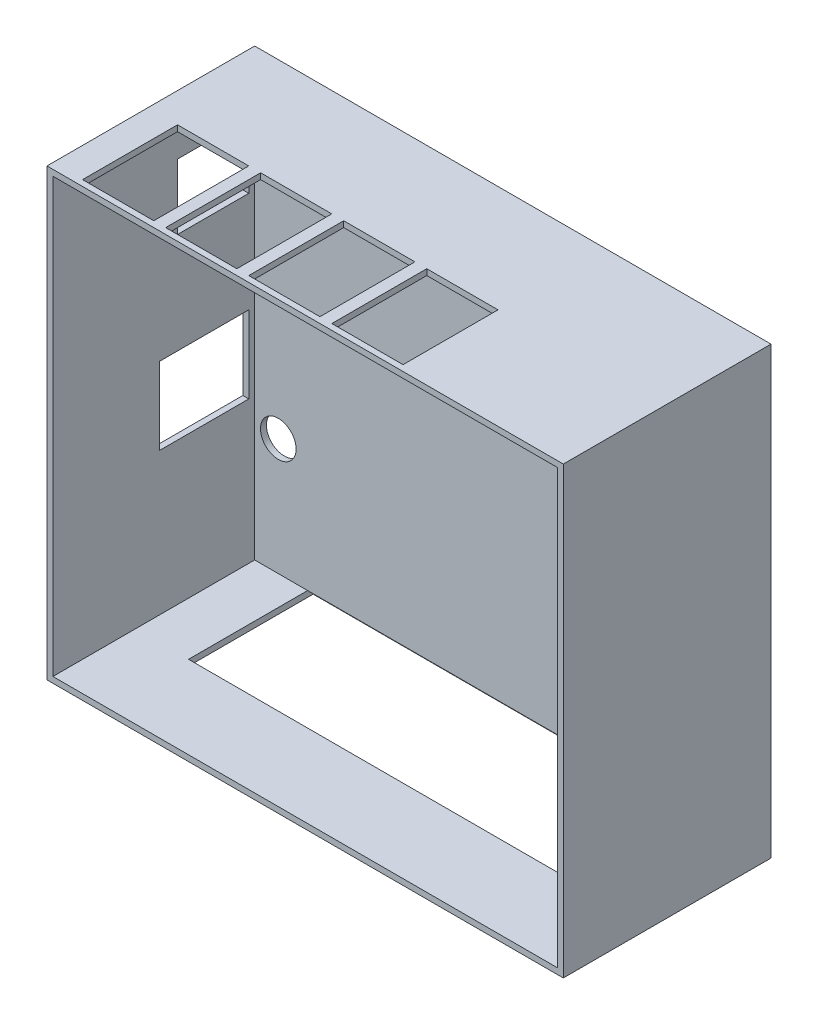
from build123d import *

# Parameters (mm, degrees)
ESQUISSE1_W              = 85
ESQUISSE1_H              = 73
BOSS_EXTRU_2_DEPTH       = 1
ESQUISSE6_W              = 35
ESQUISSE6_H              = 73
BOSS_EXTRU_4_DEPTH       = 1
ESQUISSE8_W              = 35
ESQUISSE8_H              = 73
BOSS_EXTRU_6_DEPTH       = 1
ESQUISSE10_W             = 12
ESQUISSE10_H             = 11
ENL_V_MAT_EXTRU_1_DEPTH  = 1
ESQUISSE11_W             = 15
ESQUISSE11_H             = 13
ENL_V_MAT_EXTRU_2_DEPTH  = 1
ESQUISSE13_W             = 87
ESQUISSE13_H             = 35
BOSS_EXTRU_8_DEPTH       = 1
ESQUISSE14_W             = 12
ESQUISSE14_H             = 16
ENL_V_MAT_EXTRU_3_DEPTH  = 1
ESQUISSE18_W             = 12
ESQUISSE18_H             = 16
ENL_V_MAT_EXTRU_5_DEPTH  = 1
ESQUISSE20_W             = 12
ESQUISSE20_H             = 16
ENL_V_MAT_EXTRU_6_DEPTH  = 1
ESQUISSE21_W             = 12
ESQUISSE21_H             = 16
ENL_V_MAT_EXTRU_7_DEPTH  = 1
ESQUISSE25_W             = 87
ESQUISSE25_H             = 35
BOSS_EXTRU_11_DEPTH      = 1
ESQUISSE26_W             = 77
ESQUISSE26_H             = 21
ENL_V_MAT_EXTRU_13_DEPTH = 1
ESQUISSE23_R             = 3
ENL_V_MAT_EXTRU_14_DEPTH = 10
ESQUISSE22_R             = 3
ENL_V_MAT_EXTRU_15_DEPTH = 10
ESQUISSE24_R             = 3
ENL_V_MAT_EXTRU_18_DEPTH = 10


with BuildPart() as part:
    # Esquisse1 → Boss.-Extru.2 (new body)
    with BuildSketch(Plane.XY):
        with Locations((-89.704998798, 36.5)):
            Rectangle(ESQUISSE1_W, ESQUISSE1_H)
    extrude(amount=BOSS_EXTRU_2_DEPTH)

    # Esquisse6 → Boss.-Extru.4 (add)
    with BuildSketch(Plane(origin=(-47.204998798, 0, 0), x_dir=(0, 0, -1), z_dir=(1, 0, 0))):
        with Locations((-17.5, 36.5)):
            Rectangle(ESQUISSE6_W, ESQUISSE6_H)
    extrude(amount=BOSS_EXTRU_4_DEPTH)

    # Esquisse8 → Boss.-Extru.6 (add)
    with BuildSketch(Plane.ZY.offset(132.204998798)):
        with Locations((17.5, 36.5)):
            Rectangle(ESQUISSE8_W, ESQUISSE8_H)
    extrude(amount=BOSS_EXTRU_6_DEPTH)

    # Esquisse10 → Enlèv. mat.-Extru.1 (cut)
    with BuildSketch(Plane.ZY.offset(133.204998798)):
        with Locations((8, 59.5)):
            Rectangle(ESQUISSE10_W, ESQUISSE10_H)
    extrude(amount=-ENL_V_MAT_EXTRU_1_DEPTH, mode=Mode.SUBTRACT)

    # Esquisse11 → Enlèv. mat.-Extru.2 (cut)
    with BuildSketch(Plane.ZY.offset(133.204998798)):
        with Locations((9.5, 30.5)):
            Rectangle(ESQUISSE11_W, ESQUISSE11_H)
    extrude(amount=-ENL_V_MAT_EXTRU_2_DEPTH, mode=Mode.SUBTRACT)

    # Esquisse13 → Boss.-Extru.8 (add)
    with BuildSketch(Plane(origin=(0, 73, 0), x_dir=(1, 0, 0), z_dir=(0, 1, 0))):
        with Locations((-89.704998798, -17.5)):
            Rectangle(ESQUISSE13_W, ESQUISSE13_H)
    extrude(amount=BOSS_EXTRU_8_DEPTH)

    # Esquisse14 → Enlèv. mat.-Extru.3 (cut)
    with BuildSketch(Plane(origin=(0, 74, 0), x_dir=(1, 0, 0), z_dir=(0, 1, 0))):
        with Locations((-122.207040337, -26)):
            Rectangle(ESQUISSE14_W, ESQUISSE14_H)
    extrude(amount=-ENL_V_MAT_EXTRU_3_DEPTH, mode=Mode.SUBTRACT)

    # Esquisse18 → Enlèv. mat.-Extru.5 (cut)
    with BuildSketch(Plane(origin=(0, 74, 0), x_dir=(1, 0, 0), z_dir=(0, 1, 0))):
        with Locations((-108.207040337, -26)):
            Rectangle(ESQUISSE18_W, ESQUISSE18_H)
    extrude(amount=-ENL_V_MAT_EXTRU_5_DEPTH, mode=Mode.SUBTRACT)

    # Esquisse20 → Enlèv. mat.-Extru.6 (cut)
    with BuildSketch(Plane(origin=(0, 74, 0), x_dir=(1, 0, 0), z_dir=(0, 1, 0))):
        with Locations((-94.207040337, -26)):
            Rectangle(ESQUISSE20_W, ESQUISSE20_H)
    extrude(amount=-ENL_V_MAT_EXTRU_6_DEPTH, mode=Mode.SUBTRACT)

    # Esquisse21 → Enlèv. mat.-Extru.7 (cut)
    with BuildSketch(Plane(origin=(0, 74, 0), x_dir=(1, 0, 0), z_dir=(0, 1, 0))):
        with Locations((-80.207040337, -26)):
            Rectangle(ESQUISSE21_W, ESQUISSE21_H)
    extrude(amount=-ENL_V_MAT_EXTRU_7_DEPTH, mode=Mode.SUBTRACT)

    # Esquisse25 → Boss.-Extru.11 (add)
    with BuildSketch(Plane.XZ):
        with Locations((-89.704998798, 17.5)):
            Rectangle(ESQUISSE25_W, ESQUISSE25_H)
    extrude(amount=BOSS_EXTRU_11_DEPTH)

    # Esquisse26 → Enlèv. mat.-Extru.13 (cut)
    with BuildSketch(Plane.XZ.offset(1)):
        with Locations((-84.785991567, 10.567106243)):
            Rectangle(ESQUISSE26_W, ESQUISSE26_H)
    extrude(amount=-ENL_V_MAT_EXTRU_13_DEPTH, mode=Mode.SUBTRACT)

    # Esquisse23 → Enlèv. mat.-Extru.14 (cut)
    with BuildSketch(Plane.XY.offset(1)):
        with Locations((-128.228777758, 19.66052326)):
            Circle(ESQUISSE23_R)
    extrude(amount=-ENL_V_MAT_EXTRU_14_DEPTH, mode=Mode.SUBTRACT)

    # Esquisse22 → Enlèv. mat.-Extru.15 (cut)
    with BuildSketch(Plane.XY.offset(1)):
        with Locations((-128.334603856, 69.17039525)):
            Circle(ESQUISSE22_R)
    extrude(amount=-ENL_V_MAT_EXTRU_15_DEPTH, mode=Mode.SUBTRACT)

    # Esquisse24 → Enlèv. mat.-Extru.18 (cut)
    with BuildSketch(Plane.XY.offset(1)):
        with Locations((-70.21638406, 69.222983718)):
            Circle(ESQUISSE24_R)
    extrude(amount=-ENL_V_MAT_EXTRU_18_DEPTH, mode=Mode.SUBTRACT)


solid = part.part
